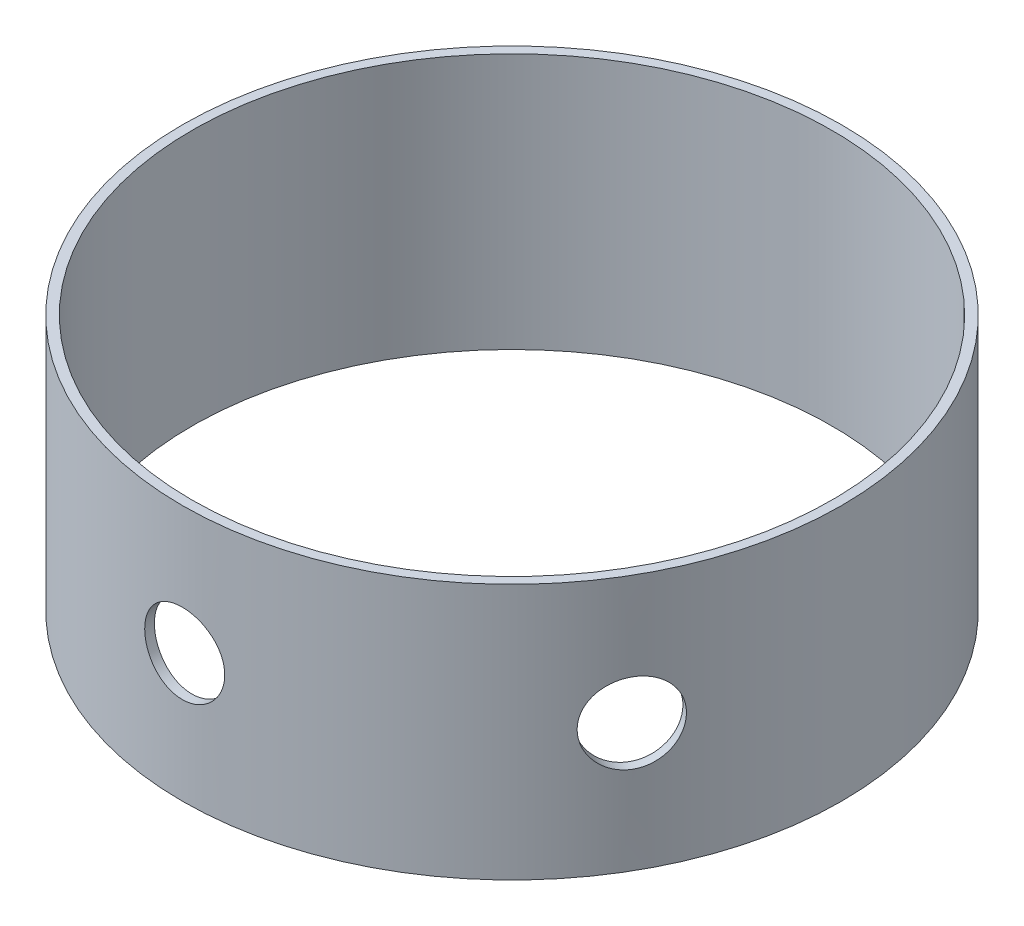
from build123d import *

# Parameters (mm, degrees)
SKETCH1_R                        = 65.405
SKETCH1_R_2                      = 63.5
BOSS_EXTRUDE1_DEPTH              = 25.4
F_5_8_0_625_DIAMETER_HOLE1_D     = 15.875
F_5_8_0_625_DIAMETER_HOLE1_DEPTH = 3.81
F_5_8_0_625_DIAMETER_HOLE2_D     = 15.875
F_5_8_0_625_DIAMETER_HOLE2_DEPTH = 3.81


with BuildPart() as part:
    # Sketch1 → Boss-Extrude1 (new, symmetric)
    with BuildSketch(Plane(origin=(0, 0, 0), x_dir=(1, 0, 0), z_dir=(0, 1, 0))):
        Circle(SKETCH1_R)
        Circle(SKETCH1_R_2, mode=Mode.SUBTRACT)
    extrude(amount=BOSS_EXTRUDE1_DEPTH, both=True)

    # 5/8 (0.625) Diameter Hole1
    with Locations(Plane(origin=(56.642391535, 0, 32.7025), x_dir=(0, -1, 0), z_dir=(0.8660254037844398, 0, 0.499999999999998))):
        with Locations((0, 0)):
            Hole(F_5_8_0_625_DIAMETER_HOLE1_D / 2, depth=F_5_8_0_625_DIAMETER_HOLE1_DEPTH)

    # 5/8 (0.625) Diameter Hole2
    with Locations(Plane.XY.offset(65.405)):
        with Locations((0, 0)):
            Hole(F_5_8_0_625_DIAMETER_HOLE2_D / 2, depth=F_5_8_0_625_DIAMETER_HOLE2_DEPTH)


solid = part.part
